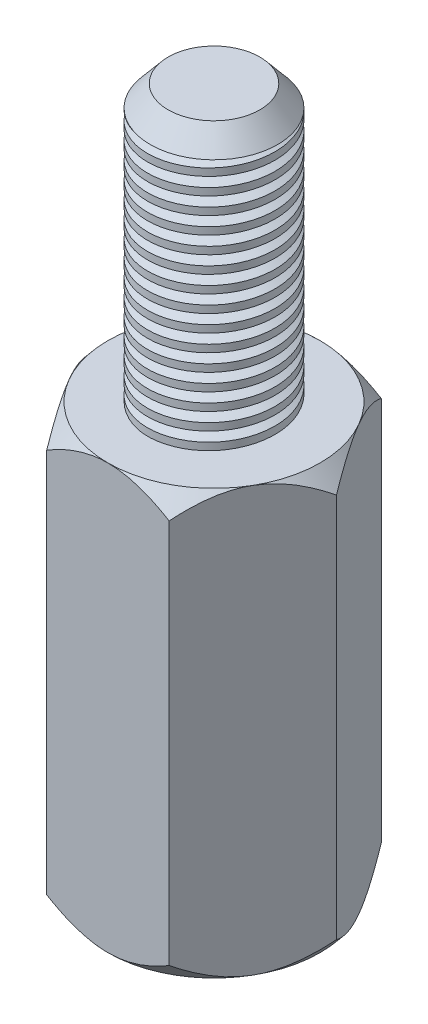
from build123d import *

# Parameters (mm, degrees)
BOSS_EXTRUDE1_DEPTH = 10
SKETCH2_R           = 1.5
CUT_EXTRUDE1_DEPTH  = 7
SKETCH3_OUTSIDE_W   = 11.13
SKETCH3_OUTSIDE_H   = 10.356
SKETCH3_OUTSIDE_R   = 2.5
CUT_EXTRUDE2_DEPTH  = 0.5
CUT_EXTRUDE2_DRAFT  = -40
SKETCH4_R           = 1.5
BOSS_EXTRUDE3_DEPTH = 6
SKETCH5_OUTSIDE_W   = 12.158
SKETCH5_OUTSIDE_H   = 11.384
SKETCH5_OUTSIDE_R   = 2.5
CUT_EXTRUDE3_DEPTH  = 0.5
CUT_EXTRUDE3_DRAFT  = -40
CUT_SWEEP1_PITCH    = 0.4
CUT_SWEEP1_TO       = 6
SKETCH8_R           = 1.5
BOSS_EXTRUDE4_DEPTH = 0.5
BOSS_EXTRUDE4_TAPER = 40
CUT_SWEEP2_PITCH    = 0.4
CUT_SWEEP2_FROM     = 0


with BuildPart() as part:
    # Sketch1 → Boss-Extrude1 (new body)
    with BuildSketch(Plane(origin=(0, 0, 0), x_dir=(1, 0, 0), z_dir=(0, 1, 0))):
        Polygon((2.886751346, 0), (1.443375673, 2.5), (-1.443375673, 2.5), (-2.886751346, 0), (-1.443375673, -2.5), (1.443375673, -2.5), align=None)
    extrude(amount=BOSS_EXTRUDE1_DEPTH)

    # Sketch2 → Cut-Extrude1 (cut)
    with BuildSketch(Plane.XZ):
        with Locations(Location((0, 0, 0), (0, 0, 270))):
            Circle(SKETCH2_R)
    extrude(amount=-CUT_EXTRUDE1_DEPTH, mode=Mode.SUBTRACT)


with BuildPart() as cut_extrude2_tool:
    # Sketch3 outside → Cut-Extrude2 (with draft: the straight prism first)
    with BuildSketch(Plane(origin=(0, 10, 0), x_dir=(1, 0, 0), z_dir=(0, 1, 0))):
        Rectangle(SKETCH3_OUTSIDE_W, SKETCH3_OUTSIDE_H)
        Circle(SKETCH3_OUTSIDE_R, mode=Mode.SUBTRACT)
    extrude(amount=-CUT_EXTRUDE2_DEPTH)
    # Cut-Extrude2: the draft: its side faces are tilted about the plane it starts from
    cut_extrude2_sides = [cut_extrude2_tool.faces().sort_by_distance(p)[0] for p in [
        (0, 9.75, 5.178),
        (5.565, 9.75, 0),
        (0, 9.75, -5.178),
        (-5.565, 9.75, 0),
        (-2.5, 9.75, 0),
    ]]
    draft(cut_extrude2_sides, Plane(origin=(0, 10, 0), x_dir=(1, 0, 0), z_dir=(0, 1, 0)), CUT_EXTRUDE2_DRAFT)


with BuildPart() as part_1:
    add(part.part)

    # Cut-Extrude2: cut by cut_extrude2_tool
    add(cut_extrude2_tool.part, mode=Mode.SUBTRACT)

    # Sketch4 → Boss-Extrude3 (add)
    with BuildSketch(Plane(origin=(0, 10, 0), x_dir=(1, 0, 0), z_dir=(0, 1, 0))):
        with Locations(Location((0, 0, 0), (0, 0, 90))):
            Circle(SKETCH4_R)
    extrude(amount=BOSS_EXTRUDE3_DEPTH)


with BuildPart() as cut_extrude3_tool:
    # Sketch5 outside → Cut-Extrude3 (with draft: the straight prism first)
    with BuildSketch(Plane.XZ):
        Rectangle(SKETCH5_OUTSIDE_W, SKETCH5_OUTSIDE_H)
        Circle(SKETCH5_OUTSIDE_R, mode=Mode.SUBTRACT)
    extrude(amount=-CUT_EXTRUDE3_DEPTH)
    # Cut-Extrude3: the draft: its side faces are tilted about the plane it starts from
    cut_extrude3_sides = [cut_extrude3_tool.faces().sort_by_distance(p)[0] for p in [
        (0, 0.25, -5.692),
        (6.079, 0.25, 0),
        (0, 0.25, 5.692),
        (-6.079, 0.25, 0),
        (-2.5, 0.25, 0),
    ]]
    draft(cut_extrude3_sides, Plane.XZ, CUT_EXTRUDE3_DRAFT)


with BuildPart() as part_2:
    add(part_1.part)

    # Cut-Extrude3: cut by cut_extrude3_tool
    add(cut_extrude3_tool.part, mode=Mode.SUBTRACT)

    # Cut-Sweep1: arcs per turn and ends read off the stored shape
    # Cut-Sweep1: the profile of Sketch7 screwed along a right-hand helix through 16.666667 turns, 6 arcs to a turn; built about Z, then put on its axis
    cut_sweep1_z = Axis((0, 0, 0), (0, 0, 1))
    cut_sweep1_corners = [(1.303700908, 0, -0.4), (1.598149546, 0, -0.23), (1.598149546, 0, -0.57)]
    with BuildLine(mode=Mode.PRIVATE) as cut_sweep1_profile:
        Line(cut_sweep1_corners[0], cut_sweep1_corners[1])
        Line(cut_sweep1_corners[1], cut_sweep1_corners[2])
        Line(cut_sweep1_corners[2], cut_sweep1_corners[0])
    cut_sweep1_cap = Face(cut_sweep1_profile.wire())
    cut_sweep1_turn_angles = [0, 30, 60, 90, 120, 150, 180, 210, 240, 270, 300, 330, 360]
    cut_sweep1_turn_weights = [1, 0.8660254037844387, 1, 0.8660254037844387, 1, 0.8660254037844387, 1, 0.8660254037844387, 1, 0.8660254037844387, 1, 0.8660254037844387, 1]
    cut_sweep1_turn_rails = [Edge.make_bspline([Vector(p[0], p[1], 0).rotate(cut_sweep1_z, cut_sweep1_turn_angles[k]) / cut_sweep1_turn_weights[k] + Vector(0, 0, p[2] + CUT_SWEEP1_PITCH * cut_sweep1_turn_angles[k] / 360) for k in range(13)], [0, 0, 0, 1, 1, 2, 2, 3, 3, 4, 4, 5, 5, 6, 6, 6], 2, cut_sweep1_turn_weights) for p in cut_sweep1_corners]
    cut_sweep1_turn_sides = [Face.make_surface_from_curves(cut_sweep1_turn_rails[p[0]], cut_sweep1_turn_rails[p[1]]) for p in [(0, 1), (1, 2), (2, 0)]]
    cut_sweep1_last_angles = [5760, 5790, 5820, 5850, 5880, 5910, 5940, 5970, 6000]
    cut_sweep1_last_weights = [1, 0.8660254037844387, 1, 0.8660254037844387, 1, 0.8660254037844387, 1, 0.8660254037844387, 1]
    cut_sweep1_last_rails = [Edge.make_bspline([Vector(p[0], p[1], 0).rotate(cut_sweep1_z, cut_sweep1_last_angles[k]) / cut_sweep1_last_weights[k] + Vector(0, 0, p[2] + CUT_SWEEP1_PITCH * cut_sweep1_last_angles[k] / 360) for k in range(9)], [0, 0, 0, 1, 1, 2, 2, 3, 3, 4, 4, 4], 2, cut_sweep1_last_weights) for p in cut_sweep1_corners]
    cut_sweep1_last_sides = [Face.make_surface_from_curves(cut_sweep1_last_rails[p[0]], cut_sweep1_last_rails[p[1]]) for p in [(0, 1), (1, 2), (2, 0)]]
    cut_sweep1 = Plane(origin=(0, 16, 0), x_dir=(1, 0, 0), z_dir=(0, -1, 0)) * split(Solid(Shell([*[p.moved(Location((0, 0, CUT_SWEEP1_PITCH * i))) for i in range(16) for p in cut_sweep1_turn_sides], *cut_sweep1_last_sides, cut_sweep1_cap, cut_sweep1_cap.rotate(cut_sweep1_z, 6000).moved(Location((0, 0, CUT_SWEEP1_PITCH * 6000 / 360)))])), bisect_by=Plane.XY.offset(CUT_SWEEP1_TO), keep=Keep.BOTTOM, mode=Mode.PRIVATE)
    add(cut_sweep1, mode=Mode.SUBTRACT)

    # Sketch8 → Boss-Extrude4 (add)
    with BuildSketch(Plane(origin=(0, 16, 0), x_dir=(1, 0, 0), z_dir=(0, 1, 0))):
        with Locations(Location((0, 0, 0), (0, 0, 90))):
            Circle(SKETCH8_R)
    extrude(amount=BOSS_EXTRUDE4_DEPTH, taper=BOSS_EXTRUDE4_TAPER)

    # Cut-Sweep2: arcs per turn and ends read off the stored shape
    # Cut-Sweep2: the profile of Sketch10 screwed along a left-hand helix through 19.75 turns, 6 arcs to a turn; built about Z, then put on its axis
    cut_sweep2_z = Axis((0, 0, 0), (0, 0, 1))
    cut_sweep2_corners = [(1.690620886, 0, -0.405496271), (1.396172248, 0, -0.235496271), (1.396172248, 0, -0.575496271)]
    with BuildLine(mode=Mode.PRIVATE) as cut_sweep2_profile:
        Line(cut_sweep2_corners[0], cut_sweep2_corners[1])
        Line(cut_sweep2_corners[1], cut_sweep2_corners[2])
        Line(cut_sweep2_corners[2], cut_sweep2_corners[0])
    cut_sweep2_cap = Face(cut_sweep2_profile.wire())
    cut_sweep2_turn_angles = [0, -30, -60, -90, -120, -150, -180, -210, -240, -270, -300, -330, -360]
    cut_sweep2_turn_weights = [1, 0.8660254037844387, 1, 0.8660254037844387, 1, 0.8660254037844387, 1, 0.8660254037844387, 1, 0.8660254037844387, 1, 0.8660254037844387, 1]
    cut_sweep2_turn_rails = [Edge.make_bspline([Vector(p[0], p[1], 0).rotate(cut_sweep2_z, cut_sweep2_turn_angles[k]) / cut_sweep2_turn_weights[k] + Vector(0, 0, p[2] + -CUT_SWEEP2_PITCH * cut_sweep2_turn_angles[k] / 360) for k in range(13)], [0, 0, 0, 1, 1, 2, 2, 3, 3, 4, 4, 5, 5, 6, 6, 6], 2, cut_sweep2_turn_weights) for p in cut_sweep2_corners]
    cut_sweep2_turn_sides = [Face.make_surface_from_curves(cut_sweep2_turn_rails[p[0]], cut_sweep2_turn_rails[p[1]]) for p in [(0, 1), (1, 2), (2, 0)]]
    cut_sweep2_last_angles = [-6840, -6870, -6900, -6930, -6960, -6990, -7020, -7050, -7080, -7095, -7110]
    cut_sweep2_last_weights = [1, 0.8660254037844387, 1, 0.8660254037844387, 1, 0.8660254037844387, 1, 0.8660254037844387, 1, 0.9659258262890683, 1]
    cut_sweep2_last_rails = [Edge.make_bspline([Vector(p[0], p[1], 0).rotate(cut_sweep2_z, cut_sweep2_last_angles[k]) / cut_sweep2_last_weights[k] + Vector(0, 0, p[2] + -CUT_SWEEP2_PITCH * cut_sweep2_last_angles[k] / 360) for k in range(11)], [0, 0, 0, 1, 1, 2, 2, 3, 3, 4, 4, 5, 5, 5], 2, cut_sweep2_last_weights) for p in cut_sweep2_corners]
    cut_sweep2_last_sides = [Face.make_surface_from_curves(cut_sweep2_last_rails[p[0]], cut_sweep2_last_rails[p[1]]) for p in [(0, 1), (1, 2), (2, 0)]]
    cut_sweep2 = Plane(origin=(0, 7, 0), x_dir=(1, 0, 0), z_dir=(0, -1, 0)) * split(Solid(Shell([*[p.moved(Location((0, 0, CUT_SWEEP2_PITCH * i))) for i in range(19) for p in cut_sweep2_turn_sides], *cut_sweep2_last_sides, cut_sweep2_cap, cut_sweep2_cap.rotate(cut_sweep2_z, -7110).moved(Location((0, 0, -CUT_SWEEP2_PITCH * -7110 / 360)))])), bisect_by=Plane.XY.offset(CUT_SWEEP2_FROM), keep=Keep.TOP, mode=Mode.PRIVATE)
    add(cut_sweep2, mode=Mode.SUBTRACT)


solid = part_2.part
